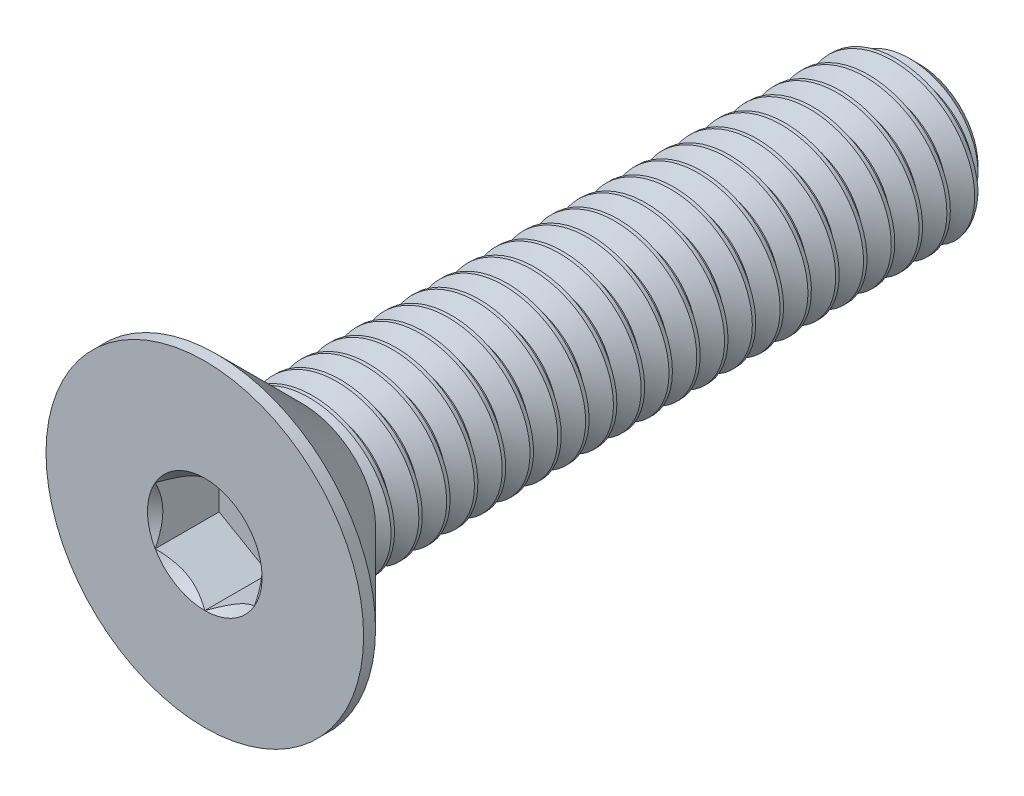
from build123d import *
from build123d.topology import SkipClean

# Parameters (mm, degrees)
SKETCH1_W          = 18
SKETCH1_H          = 2
CHAMFER1_SIZE      = 0.525
CUT_SWEEP1_PITCH   = 0.7
CUT_EXTRUDE2_DEPTH = 1.61


with BuildPart() as part:
    # Sketch1 → Revolve1 (revolve)
    with BuildSketch(Plane(origin=(0, 0, 0), x_dir=(0, 0, -1), z_dir=(1, 0, 0))):
        with Locations((9, 1)):
            Rectangle(SKETCH1_W, SKETCH1_H)
    revolve(axis=Axis((0, 0, -18), (0, 0, 1)))

    # Chamfer1
    chamfer1_edges = [part.edges().sort_by_distance(p)[0] for p in [
        (0, -2, -18),
    ]]
    chamfer(chamfer1_edges, length=CHAMFER1_SIZE)

    # Cut-Sweep1: arcs per turn and ends read off the stored shape
    # Cut-Sweep1: the profile of Sketch2 profile screwed along a right-hand helix through 26.666667 turns, 6 arcs to a turn; built about Z, then put on its axis
    cut_sweep1_z = Axis((0, 0, 0), (0, 0, 1))
    cut_sweep1_corners = [(2.0003, 0, 0.000173205), (2.0003, 0, -0.612673205), (1.545336663, 0, -0.35), (1.545336663, 0, -0.2625)]
    with BuildLine(mode=Mode.PRIVATE) as cut_sweep1_profile:
        Line(cut_sweep1_corners[0], cut_sweep1_corners[1])
        Line(cut_sweep1_corners[1], cut_sweep1_corners[2])
        Line(cut_sweep1_corners[2], cut_sweep1_corners[3])
        Line(cut_sweep1_corners[3], cut_sweep1_corners[0])
    cut_sweep1_cap = Face(cut_sweep1_profile.wire())
    cut_sweep1_turn_angles = [0, 30, 60, 90, 120, 150, 180, 210, 240, 270, 300, 330, 360]
    cut_sweep1_turn_weights = [1, 0.8660254037844387, 1, 0.8660254037844387, 1, 0.8660254037844387, 1, 0.8660254037844387, 1, 0.8660254037844387, 1, 0.8660254037844387, 1]
    cut_sweep1_turn_rails = [Edge.make_bspline([Vector(p[0], p[1], 0).rotate(cut_sweep1_z, cut_sweep1_turn_angles[k]) / cut_sweep1_turn_weights[k] + Vector(0, 0, p[2] + CUT_SWEEP1_PITCH * cut_sweep1_turn_angles[k] / 360) for k in range(13)], [0, 0, 0, 1, 1, 2, 2, 3, 3, 4, 4, 5, 5, 6, 6, 6], 2, cut_sweep1_turn_weights) for p in cut_sweep1_corners]
    cut_sweep1_turn_sides = [Face.make_surface_from_curves(cut_sweep1_turn_rails[p[0]], cut_sweep1_turn_rails[p[1]]) for p in [(0, 1), (1, 2), (2, 3), (3, 0)]]
    cut_sweep1_last_angles = [9360, 9390, 9420, 9450, 9480, 9510, 9540, 9570, 9600]
    cut_sweep1_last_weights = [1, 0.8660254037844387, 1, 0.8660254037844387, 1, 0.8660254037844387, 1, 0.8660254037844387, 1]
    cut_sweep1_last_rails = [Edge.make_bspline([Vector(p[0], p[1], 0).rotate(cut_sweep1_z, cut_sweep1_last_angles[k]) / cut_sweep1_last_weights[k] + Vector(0, 0, p[2] + CUT_SWEEP1_PITCH * cut_sweep1_last_angles[k] / 360) for k in range(9)], [0, 0, 0, 1, 1, 2, 2, 3, 3, 4, 4, 4], 2, cut_sweep1_last_weights) for p in cut_sweep1_corners]
    cut_sweep1_last_sides = [Face.make_surface_from_curves(cut_sweep1_last_rails[p[0]], cut_sweep1_last_rails[p[1]]) for p in [(0, 1), (1, 2), (2, 3), (3, 0)]]
    cut_sweep1 = Plane(origin=(0, 0, -18), x_dir=(0, 1, 0), z_dir=(0, 0, 1)) * Solid(Shell([*[p.moved(Location((0, 0, CUT_SWEEP1_PITCH * i))) for i in range(26) for p in cut_sweep1_turn_sides], *cut_sweep1_last_sides, cut_sweep1_cap, cut_sweep1_cap.rotate(cut_sweep1_z, 9600).moved(Location((0, 0, CUT_SWEEP1_PITCH * 9600 / 360)))]))
    add(cut_sweep1, mode=Mode.SUBTRACT)

    # Sketch7 → Revolve2 (revolve)
    with BuildSketch(Plane(origin=(0, 0, 0), x_dir=(0, 0, -1), z_dir=(1, 0, 0)), mode=Mode.PRIVATE) as revolve2_sk:
        Polygon((0, 4), (0.3, 4), (2.3, 2), (2.3, 0), (0, 0), align=None)
    revolve(revolve2_sk.sketch.rotate(Axis((0, 0, 0), (0, 0, -1)), 189.336081704), axis=Axis((0, 0, 0), (0, 0, -1)))

    # Boss-Extrude1 cone 1 section (through the dimple's axis) → Boss-Extrude1 (revolve)
    with SkipClean():  # the faces are left unmerged after this step: merging them gives an invalid solid
        with BuildSketch(Plane(origin=(0, 0, -2.3), x_dir=(0, -1, 0), z_dir=(1, 0, 0))):
            Polygon((0, 0), (2, 0), (0, 2), align=None)
        revolve(axis=Axis((0, 0, -2.3), (0, 0, -1)))

    # Sketch5 → Cut-Extrude2 (cut)
    with SkipClean():  # the faces are left unmerged after this step: merging them gives an invalid solid
        with BuildSketch(Plane.XY):
            Polygon((1.25, -0.721687836), (1.25, 0.721687836), (0, 1.443375673), (-1.25, 0.721687836), (-1.25, -0.721687836), (0, -1.443375673), align=None)
        extrude(amount=-CUT_EXTRUDE2_DEPTH, mode=Mode.SUBTRACT)

    # Cut-Extrude3 cone 1 section (through the dimple's axis) → Cut-Extrude3 (revolve, cut)
    with SkipClean():  # the faces are left unmerged after this step: merging them gives an invalid solid
        with BuildSketch(Plane(origin=(0, 0, 0), x_dir=(0, -1, 0), z_dir=(1, 0, 0))):
            Polygon((0, 0), (1.443375673, 0), (0, 1.443375673), align=None)
        revolve(axis=Axis((0, 0, 0), (0, 0, -1)), mode=Mode.SUBTRACT)


solid = part.part
